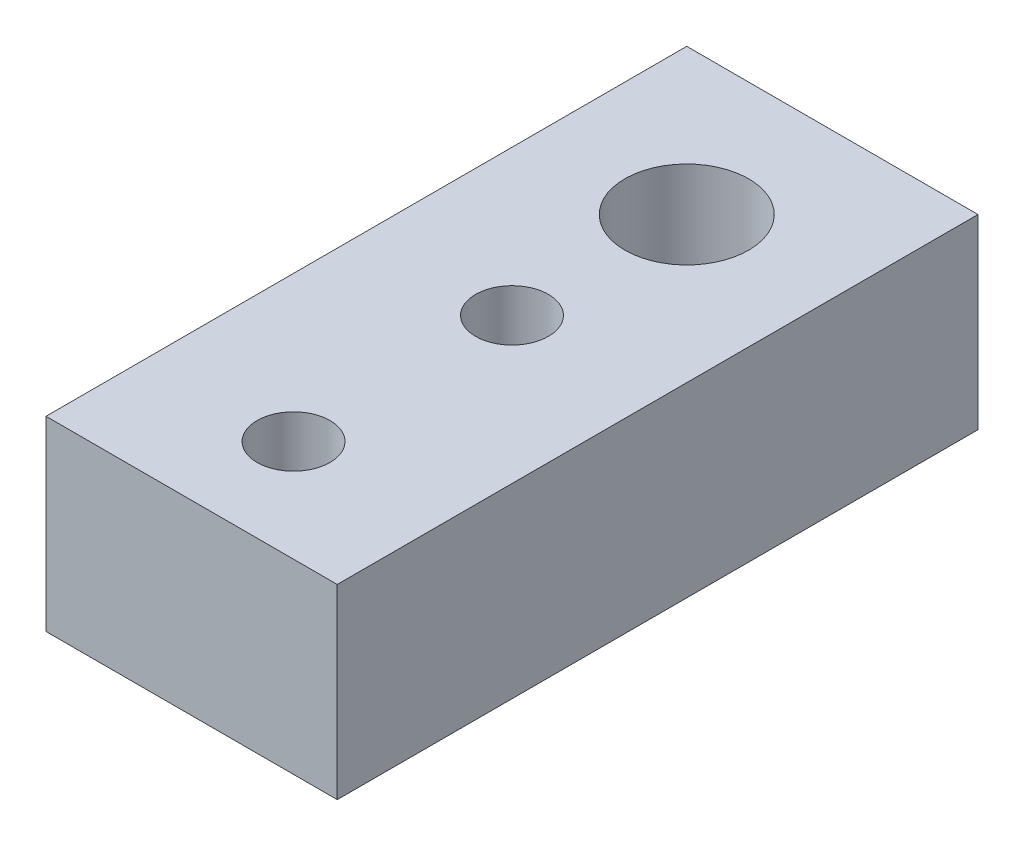
from build123d import *

# Parameters (mm, degrees)
SKETCH1_W              = 20
SKETCH1_H              = 12.8
BOSS_EXTRUDE1_DEPTH    = 22
M6X1_0_TAPPED_HOLE1_D  = 5
M10X1_5_TAPPED_HOLE1_D = 8.5


with BuildPart() as part:
    # Sketch1 → Boss-Extrude1 (new, symmetric)
    with BuildSketch(Plane.XY):
        Rectangle(SKETCH1_W, SKETCH1_H)
    extrude(amount=BOSS_EXTRUDE1_DEPTH, both=True)

    # M6x1.0 Tapped Hole1 (through all)
    with Locations(Plane(origin=(0, 6.4, 0), x_dir=(1, 0, 0), z_dir=(0, 1, 0))):
        with Locations((0, -15), (0, 0), (0, 12)):
            Hole(M6X1_0_TAPPED_HOLE1_D / 2)

    # M10x1.5 Tapped Hole1 (through all)
    with Locations(Plane(origin=(0, 6.4, 0), x_dir=(1, 0, 0), z_dir=(0, 1, 0))):
        with Locations((0, 12)):
            Hole(M10X1_5_TAPPED_HOLE1_D / 2)


solid = part.part
